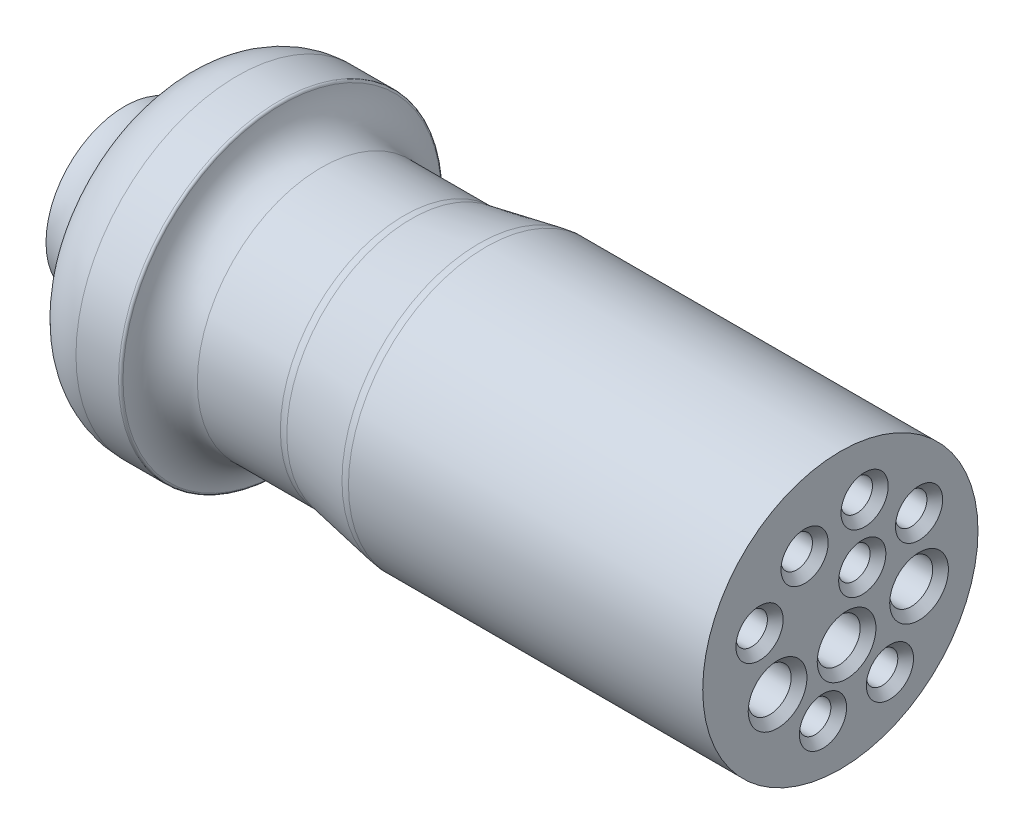
from build123d import *

# Parameters (mm, degrees)
FILLET1_R          = 5
FILLET2_R          = 0.3
FILLET3_R          = 5
SKETCH6_R          = 2.0006066698857174
SKETCH6_R_2        = 2.000606669885716
SKETCH6_R_3        = 2.733173099565215
SKETCH6_R_4        = 2.733173099565216
CUT_EXTRUDE1_DEPTH = 21
CHAMFER1_SIZE      = 1


with BuildPart() as part:
    # Sketch3 → Revolve1 (revolve)
    with BuildSketch(Plane.XY, mode=Mode.PRIVATE) as revolve1_sk:
        with BuildLine():
            Line((45.5, 0), (45.5, 17.499999999999996))
            Line((45.5, 17.499999999999996), (0, 17.500000000006253))
            Line((0, 17.500000000006253), (-9.5, 15.75))
            Line((-9.5, 15.75), (-25.499999999999996, 15.749999999999996))
            Line((-25.499999999999996, 15.749999999999996), (-25.499999999999996, 20.5))
            Line((-25.499999999999996, 20.5), (-31.190911978745817, 20.5))
            ThreePointArc((-31.190911978745817, 20.5), (-35.92377580522551, 18.949806198638836), (-38.82242559008138, 14.9))
            ThreePointArc((-38.82242559008138, 14.9), (-41.358744151830265, 11.356419576191016), (-45.5, 10))
            Line((-45.5, 10), (-45.5, 0))
            Line((-45.5, 0), (45.5, 0))
        make_face()
    revolve(revolve1_sk.sketch.rotate(Axis((0, 0, 0), (1, 0, 0)), 90), axis=Axis((0, 0, 0), (1, 0, 0)))

    # Fillet1
    # the kernel refuses this fillet: 5 mm, written as the material it adds along each edge
    with BuildSketch(Plane(origin=(-25.499999999999996, 0, 0), x_dir=(0, 1.1e-16, 1), z_dir=(0, 1, -1.1e-16))) as fillet1_piece_1:
        with BuildLine():
            CenterArc((20.75, 4.993746088859542), FILLET1_R, 180, 87.13401601740111)
            Line((20.5, -3.55e-15), (20.495, -0.09987492177719304))
            ThreePointArc((20.495, -0.09987492177719304), (18.125, -0.10000000000000142), (15.749999999999996, -0.10000000000000142))
            Line((15.749999999999996, -0.10000000000000142), (15.649999999999997, 0))
            Line((15.649999999999997, 0), (15.65, 4.993746088859542))
            Line((15.65, 4.993746088859542), (15.75, 4.993746088859542))
        make_face()
    revolve(axis=Axis((-25.499999999999996, 0, 0), (1, 0, 0)))

    # Fillet2
    fillet2_edges = [part.edges().sort_by_distance(p)[0] for p in [
        (-25.499999999999996, -1.389e-14, -20.5),
    ]]
    fillet(fillet2_edges, radius=FILLET2_R)

    # Fillet3
    fillet3_edges = [part.edges().sort_by_distance(p)[0] for p in [
        (0, -4.09e-15, -17.500000000006253),
        (-9.5, -3.68e-15, -15.75),
    ]]
    fillet(fillet3_edges, radius=FILLET3_R)

    # Sketch6 → Cut-Extrude1 (cut)
    with BuildSketch(Plane(origin=(45.5, 0, 0), x_dir=(0, 0, -1), z_dir=(1, 0, 0))):
        with Locations((2.783799240820242, 3.3453538559838196)):
            Circle(SKETCH6_R)
        with Locations((3.0830749079385766, 10.64743253142253)):
            Circle(SKETCH6_R_2)
        with Locations((-4.545344467144663, 8.222212498881614)):
            Circle(SKETCH6_R)
        with Locations((-10.277682725877737, 2.6221589691962284)):
            Circle(SKETCH6_R_2)
        with Locations((10.005975728100823, 5.708802646975575)):
            Circle(SKETCH6_R_2)
        with Locations((-2.2083142539688767, -11.091357942080581)):
            Circle(SKETCH6_R)
        with Locations((6.30200331476561, -9.944890290333964)):
            Circle(SKETCH6_R_2)
        with Locations((10.005975728100823, -2.3605658249332846)):
            Circle(SKETCH6_R_3)
        with Locations((0.7901396044453501, -4.212552031600895)):
            Circle(SKETCH6_R_3)
        with Locations((-7.98474742238451, -5.270829863982385)):
            Circle(SKETCH6_R_4)
    extrude(amount=-CUT_EXTRUDE1_DEPTH, mode=Mode.SUBTRACT)

    # Chamfer1
    chamfer1_edges = [part.edges().sort_by_distance(p)[0] for p in [
        (45.5, 5.708802646975575, -8.005369058215107),
        (45.5, 2.622158969196229, 12.278289395763453),
        (45.5, 8.222212498881614, 6.5459511370303805),
        (45.5, 10.64743253142253, -1.0824682380528605),
        (45.5, -11.091357942080581, 4.208920923854594),
        (45.5, -9.944890290333964, -4.301396644879894),
        (45.5, -2.3605658249332855, -7.272802628535608),
        (45.5, -4.212552031600896, 1.943033495119865),
        (45.5, -5.270829863982385, 10.717920521949726),
        (45.5, 3.34535385598382, -0.7831925709345247),
    ]]
    chamfer(chamfer1_edges, length=CHAMFER1_SIZE)


solid = part.part
